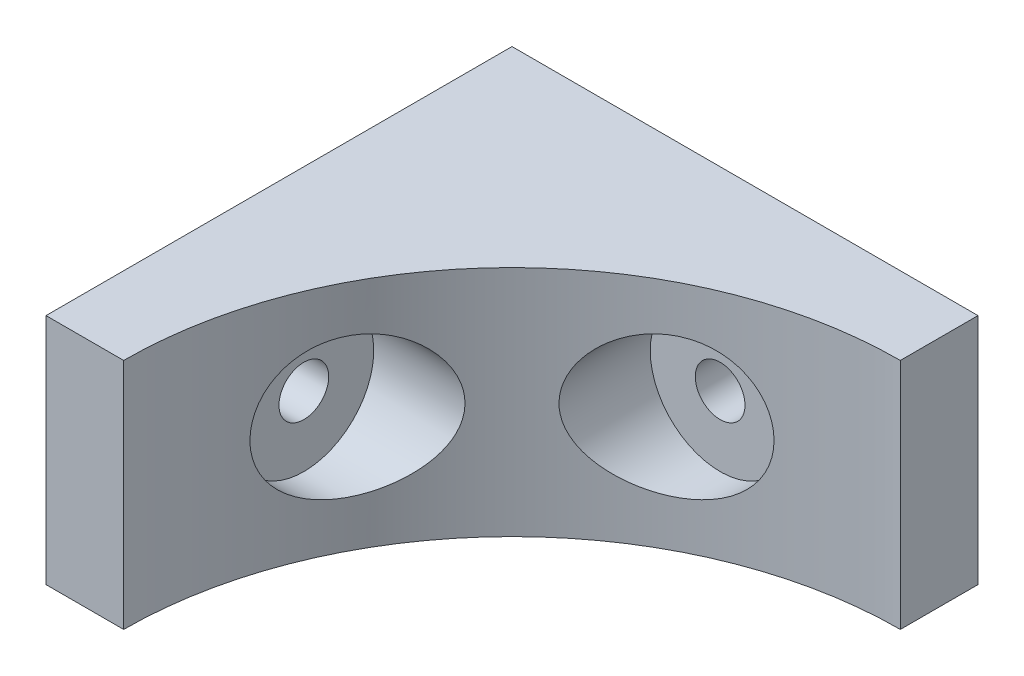
from build123d import *

# Parameters (mm, degrees)
SKETCH1_W           = 30
SKETCH1_H           = 15
SKETCH1_R           = 1.6
BOSS_EXTRUDE1_DEPTH = 5
SKETCH2_W           = 5
SKETCH2_H           = 15
BOSS_EXTRUDE2_DEPTH = 25
CUT_EXTRUDE1_REACH  = 41.765
SKETCH3_R           = 1.6
FILLET1_R           = 25
CUT_EXTRUDE2_START  = -5
SKETCH4_R           = 4.5
CUT_EXTRUDE2_DEPTH  = 39.084220006
CUT_EXTRUDE3_START  = -5
SKETCH5_R           = 4.5
CUT_EXTRUDE3_DEPTH  = 30.369317865


with BuildPart() as part:
    # Sketch1 → Boss-Extrude1 (new body)
    with BuildSketch(Plane.XY):
        Rectangle(SKETCH1_W, SKETCH1_H)
        with Locations((3.4, 0)):
            Circle(SKETCH1_R, mode=Mode.SUBTRACT)
    extrude(amount=BOSS_EXTRUDE1_DEPTH)

    # Sketch2 → Boss-Extrude2 (add)
    with BuildSketch(Plane.XY.offset(5)):
        with Locations((-12.5, 0)):
            Rectangle(SKETCH2_W, SKETCH2_H)
    extrude(amount=BOSS_EXTRUDE2_DEPTH)

    # Sketch3 → Cut-Extrude1 (cut, up to next)
    with BuildSketch(Plane(origin=(-10, 0, 0), x_dir=(0, 0, -1), z_dir=(1, 0, 0)), mode=Mode.PRIVATE) as cut_extrude1_sk1:
        with Locations(Location((-18.4, 0, 0), (0, 0, 90))):
            Circle(SKETCH3_R)
    cut_extrude1_tool1 = extrude(cut_extrude1_sk1.sketch, amount=-CUT_EXTRUDE1_REACH, mode=Mode.PRIVATE) & part.part
    add(cut_extrude1_tool1.solids().sort_by_distance((-10, 0, 18.4))[0], mode=Mode.SUBTRACT)

    # Fillet1
    # the kernel refuses this fillet: 25 mm, written as the material it adds along each edge
    with BuildSketch(Plane(origin=(-10, 7.5, 5), x_dir=(0, 0, 1), z_dir=(0, -1, 0))) as fillet1_piece_1_section:
        with BuildLine():
            CenterArc((FILLET1_R, -FILLET1_R), FILLET1_R, 90, 90)
            Line((0, -FILLET1_R), (0, 0))
            Line((0, 0), (FILLET1_R, 0))
        make_face()
    fillet1_piece_1 = extrude(amount=15, mode=Mode.PRIVATE)
    fillet1_piece_1 = fillet1_piece_1 - Plane(origin=(-4.377200925, 0, 18.4), x_dir=(0, 1, 0), z_dir=(1, 0, 0)) * Cylinder(1.6, 130, mode=Mode.PRIVATE)
    fillet1_piece_1 = fillet1_piece_1 - Plane(origin=(3.4, 0, 10.622848357), x_dir=(1, 0, 0), z_dir=(0, 0, -1)) * Cylinder(1.6, 130, mode=Mode.PRIVATE)
    add(fillet1_piece_1)

    # Sketch4 → Cut-Extrude2 (cut, through all)
    with BuildSketch(Plane.ZY.offset(15).offset(CUT_EXTRUDE2_START)):
        with Locations((18.4, 0)):
            Circle(SKETCH4_R)
    extrude(amount=-CUT_EXTRUDE2_DEPTH, mode=Mode.SUBTRACT)

    # Sketch5 → Cut-Extrude3 (cut, through all)
    with BuildSketch(Plane(origin=(0, 0, 0), x_dir=(-1, 0, 0), z_dir=(0, 0, -1)).offset(CUT_EXTRUDE3_START)):
        with Locations((-3.4, 0)):
            Circle(SKETCH5_R)
    extrude(amount=-CUT_EXTRUDE3_DEPTH, mode=Mode.SUBTRACT)


solid = part.part
